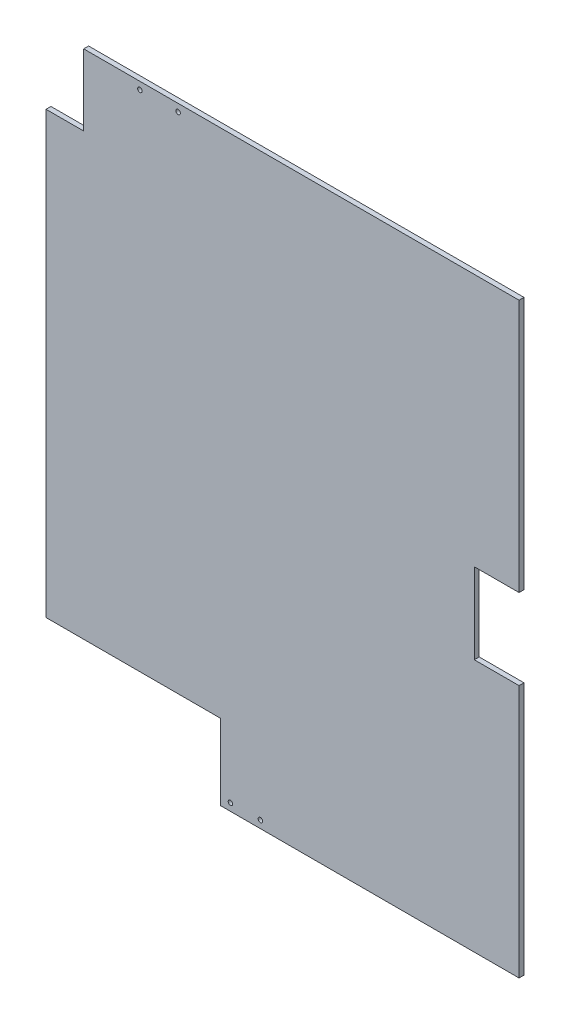
from build123d import *

# Parameters (mm, degrees)
BOSS_EXTRUDE1_DEPTH = 3.3
SKETCH2_R           = 1.5
CUT_EXTRUDE1_DEPTH  = 466.815016933
SKETCH4_W           = 30
SKETCH4_H           = 54
CUT_EXTRUDE3_DEPTH  = 10
SKETCH5_W           = 31.32455923
SKETCH5_H           = 266
CUT_EXTRUDE4_DEPTH  = 10


with BuildPart() as part:
    # Sketch1 → Boss-Extrude1 (new body)
    with BuildSketch(Plane.XY):
        Polygon((-5.782297403, 1), (-5.782297403, -13), (25.5, -13), (25.5, -225), (-5.82455923, -225), (-5.82455923, -265), (142.5, -265), (142.5, -315.7), (342.5, -315.7), (342.5, 77.7), (50.748117859, 77.7), (50.748117859, 30), (25.5, 30), (25.5, 1), align=None)
    extrude(amount=BOSS_EXTRUDE1_DEPTH)

    # Sketch2 → Cut-Extrude1 (cut, through all)
    with BuildSketch(Plane(origin=(0, 0, 0), x_dir=(-1, 0, 0), z_dir=(0, 0, -1))):
        with Locations((-113.998383462, 72.7)):
            Circle(SKETCH2_R)
        with Locations((-88.397045893, 72.7)):
            Circle(SKETCH2_R)
        with Locations((-169.168895948, -310.7)):
            Circle(SKETCH2_R)
        with Locations((-149.084447974, -310.7)):
            Circle(SKETCH2_R)
    extrude(amount=-CUT_EXTRUDE1_DEPTH, mode=Mode.SUBTRACT)

    # Sketch4 → Cut-Extrude3 (cut)
    with BuildSketch(Plane(origin=(0, 0, 0), x_dir=(-1, 0, 0), z_dir=(0, 0, -1))):
        with Locations((-327.5, -119)):
            Rectangle(SKETCH4_W, SKETCH4_H)
    extrude(amount=-CUT_EXTRUDE3_DEPTH, mode=Mode.SUBTRACT)

    # Sketch5 → Cut-Extrude4 (cut)
    with BuildSketch(Plane(origin=(0, 0, 0), x_dir=(-1, 0, 0), z_dir=(0, 0, -1))):
        with Locations((-9.837720385, -132)):
            Rectangle(SKETCH5_W, SKETCH5_H)
    extrude(amount=-CUT_EXTRUDE4_DEPTH, mode=Mode.SUBTRACT)


solid = part.part
